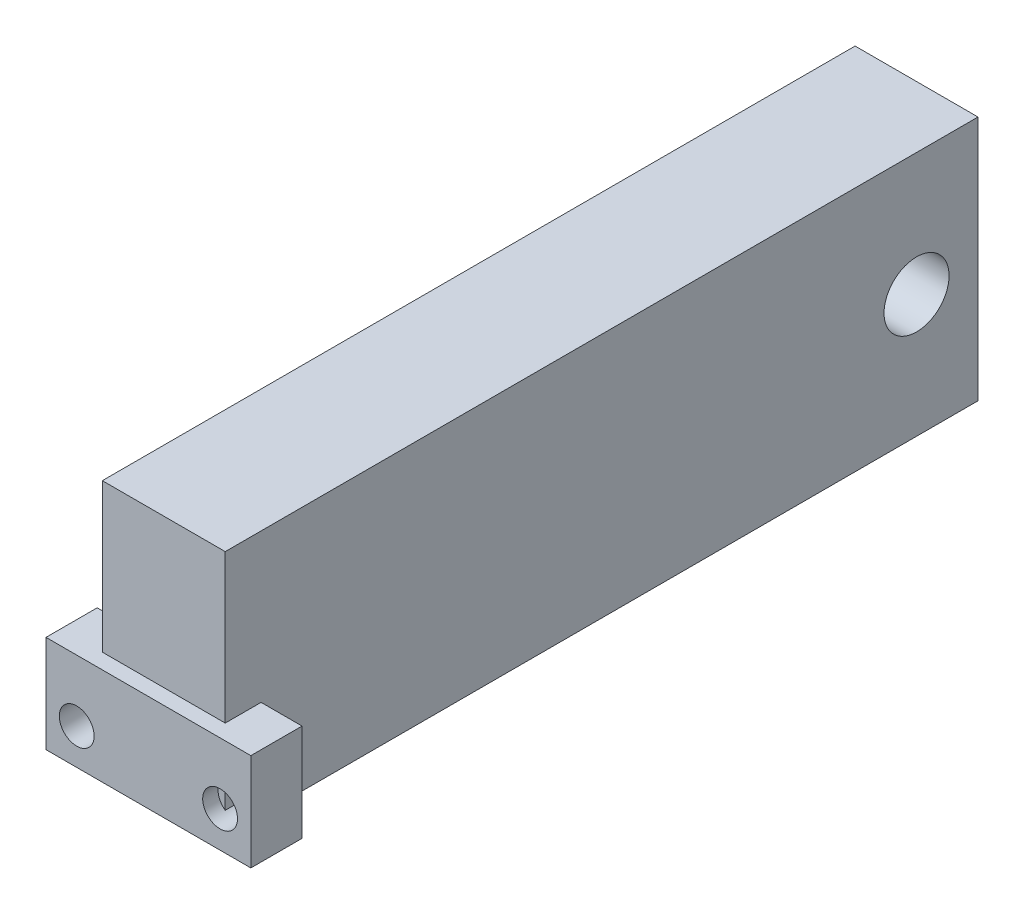
from build123d import *

# Parameters (mm, degrees)
FIVE_MM_ATTACHMENT_FOOT_START                      = -5
SKETCH1_W                                          = 20
SKETCH1_H                                          = 9.5
SKETCH1_R                                          = 1.7
FIVE_MM_ATTACHMENT_FOOT_DEPTH                      = 5
DEEP_ACTUATOR_WEB_START                            = -69
SKETCH2_W                                          = 12
SKETCH2_H                                          = 24
DEEP_ACTUATOR_WEB_DEPTH                            = 67.5
QUARTER20_AXIAL_THREAD_MAJOR_ENVELOPE_DEPTH        = 90.516758208
QUARTER20_AXIAL_THREAD_MAJOR_ENVELOPE_DEPTH_BACK   = 90.516758208
SKETCH3_R                                          = 3.175
BENCH_X_BORE_LOWER_LIGAMENT_START                  = -75
SKETCH4_W                                          = 12
SKETCH4_H                                          = 24
BENCH_X_BORE_LOWER_LIGAMENT_DEPTH                  = 6.01
BENCH_COMPLETE_QUARTER20_MAJOR_ENVELOPE_DEPTH      = 95.21915941
BENCH_COMPLETE_QUARTER20_MAJOR_ENVELOPE_DEPTH_BACK = 95.21915941
SKETCH5_R                                          = 3.175


with BuildPart() as part:
    # Sketch1 → Five_mm_Attachment_Foot (new body)
    with BuildSketch(Plane.XY.offset(FIVE_MM_ATTACHMENT_FOOT_START)):
        with Locations((-20, 29.25)):
            Rectangle(SKETCH1_W, SKETCH1_H)
        with Locations((-27, 28)):
            Circle(SKETCH1_R, mode=Mode.SUBTRACT)
        with Locations((-13, 28)):
            Circle(SKETCH1_R, mode=Mode.SUBTRACT)
    extrude(amount=FIVE_MM_ATTACHMENT_FOOT_DEPTH)

    # Sketch2 → Deep_Actuator_Web (add)
    with BuildSketch(Plane.XY.offset(DEEP_ACTUATOR_WEB_START)):
        with Locations((-20, 36.5)):
            Rectangle(SKETCH2_W, SKETCH2_H)
    extrude(amount=DEEP_ACTUATOR_WEB_DEPTH)

    # Sketch3 → Quarter20_Axial_Thread_Major_Envelope (cut, two sides: drawn at the far end of the back side and taken through both)
    with BuildSketch(Plane(origin=(0, 0, 0), x_dir=(0, 0, -1), z_dir=(1, 0, 0)).offset(-QUARTER20_AXIAL_THREAD_MAJOR_ENVELOPE_DEPTH_BACK)):
        with Locations((69, 36.5)):
            Circle(SKETCH3_R)
    extrude(amount=QUARTER20_AXIAL_THREAD_MAJOR_ENVELOPE_DEPTH + QUARTER20_AXIAL_THREAD_MAJOR_ENVELOPE_DEPTH_BACK, mode=Mode.SUBTRACT)

    # Sketch4 → Bench_X_Bore_Lower_Ligament (add)
    with BuildSketch(Plane.XY.offset(BENCH_X_BORE_LOWER_LIGAMENT_START)):
        with Locations((-20, 36.5)):
            Rectangle(SKETCH4_W, SKETCH4_H)
    extrude(amount=BENCH_X_BORE_LOWER_LIGAMENT_DEPTH)

    # Sketch5 → Bench_Complete_Quarter20_Major_Envelope (cut, two sides: drawn at the far end of the back side and taken through both)
    with BuildSketch(Plane(origin=(0, 0, 0), x_dir=(0, 0, -1), z_dir=(1, 0, 0)).offset(-BENCH_COMPLETE_QUARTER20_MAJOR_ENVELOPE_DEPTH_BACK)):
        with Locations((69, 36.5)):
            Circle(SKETCH5_R)
    extrude(amount=BENCH_COMPLETE_QUARTER20_MAJOR_ENVELOPE_DEPTH + BENCH_COMPLETE_QUARTER20_MAJOR_ENVELOPE_DEPTH_BACK, mode=Mode.SUBTRACT)


solid = part.part
